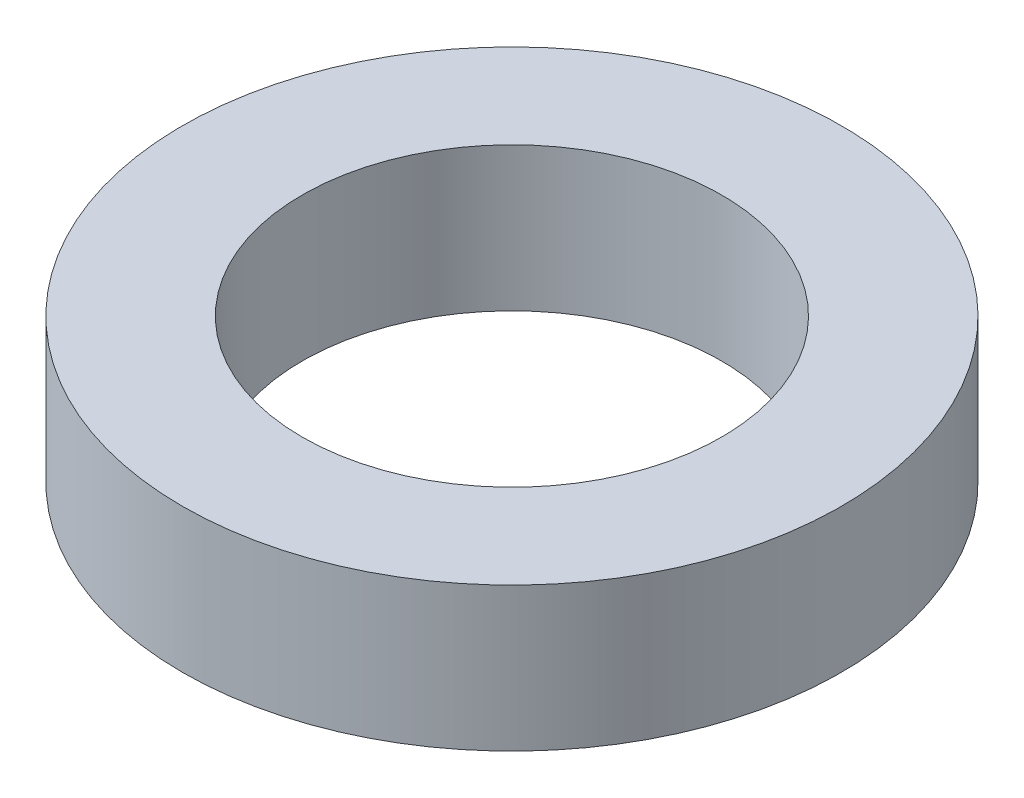
from build123d import *

# Parameters (mm, degrees)
SKETCH1_R           = 27.5
BOSS_EXTRUDE1_DEPTH = 12
SKETCH2_R           = 17.5
CUT_EXTRUDE1_DEPTH  = 41.70012285


with BuildPart() as part:
    # Sketch1 → Boss-Extrude1 (new body)
    with BuildSketch(Plane(origin=(0, 0, 0), x_dir=(1, 0, 0), z_dir=(0, 1, 0))):
        Circle(SKETCH1_R)
    extrude(amount=BOSS_EXTRUDE1_DEPTH)

    # Sketch2 → Cut-Extrude1 (cut, through all)
    with BuildSketch(Plane(origin=(0, 0, 0), x_dir=(1, 0, 0), z_dir=(0, 1, 0))):
        Circle(SKETCH2_R)
    extrude(amount=CUT_EXTRUDE1_DEPTH, mode=Mode.SUBTRACT)


solid = part.part
